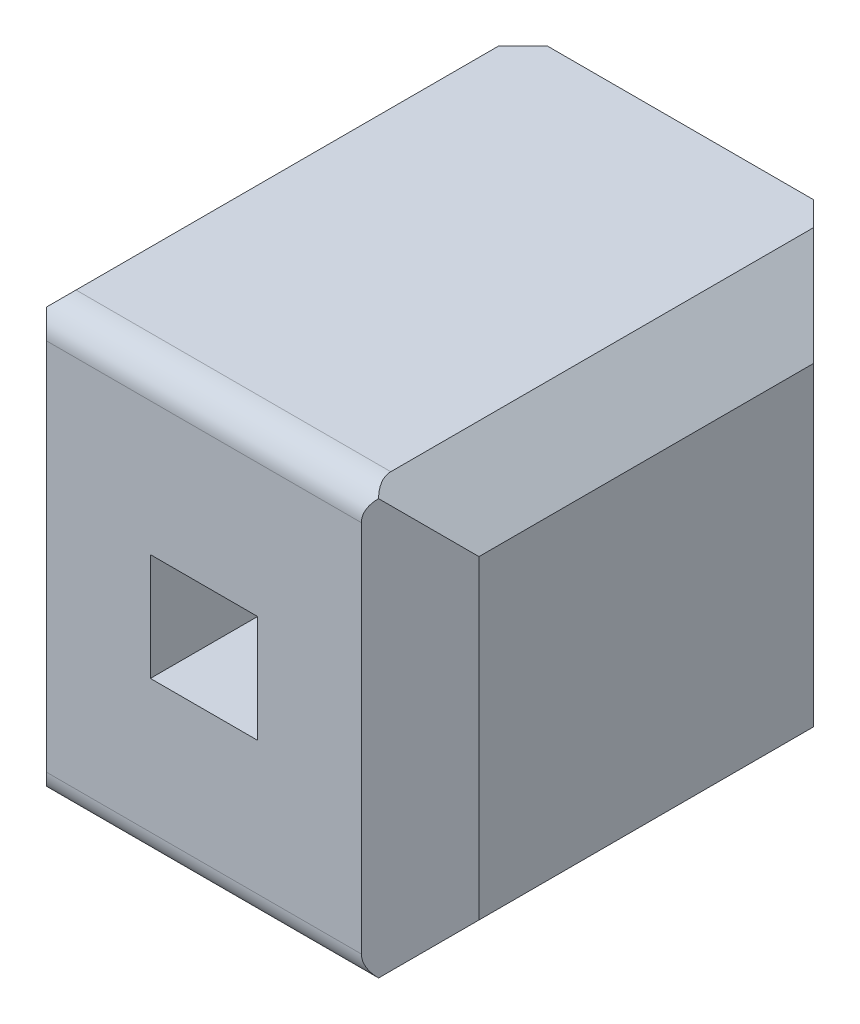
from build123d import *

# Parameters (mm, degrees)
BOSS_EXTRUDE1_DEPTH = 1.54
BOSS_EXTRUDE2_DEPTH = 0.5
SKETCH3_W           = 2.54
SKETCH3_H           = 2.04
BOSS_EXTRUDE3_DEPTH = 2.309999828
BOSS_EXTRUDE4_DEPTH = 0.5
SKETCH5_W           = 0.63
SKETCH5_H           = 0.63
CUT_EXTRUDE1_DEPTH  = 30.371228123
CHAMFER1_SIZE       = 0.345477186
FILLET1_R           = 0.172738636


with BuildPart() as part:
    # Sketch1 → Boss-Extrude1 (new body)
    with BuildSketch(Plane.XZ.offset(0.77)):
        Polygon((29.019999979, 0.299999943), (29.21, 0.49), (26.67, 0.49), (26.86, 0.299999943), align=None)
    extrude(amount=-BOSS_EXTRUDE1_DEPTH)

    # Sketch2 → Boss-Extrude2 (add)
    with BuildSketch(Plane(origin=(0, 0.77, 0), x_dir=(-1, 0, 0), z_dir=(0, 1, 0))):
        Polygon((-26.67, 0.49), (-27.158578644, 0.001421356), (-28.721421356, 0.001421356), (-29.21, 0.49), align=None)
    extrude(amount=BOSS_EXTRUDE2_DEPTH)

    # Sketch3 → Boss-Extrude3 (add)
    with BuildSketch(Plane.XY.offset(0.49)):
        with Locations((27.94, 0.25)):
            Rectangle(SKETCH3_W, SKETCH3_H)
    extrude(amount=BOSS_EXTRUDE3_DEPTH)

    # Sketch4 → Boss-Extrude4 (add)
    with BuildSketch(Plane.XZ.offset(0.77)):
        Polygon((29.21, 0.49), (28.721421356, 0.001421356), (27.158578644, 0.001421356), (26.67, 0.49), (26.67, 2.799999828), (29.21, 2.799999828), align=None)
    extrude(amount=BOSS_EXTRUDE4_DEPTH)

    # Sketch5 → Cut-Extrude1 (cut, through all)
    with BuildSketch(Plane.XY.offset(2.799999828)):
        with Locations((27.94, 0)):
            Rectangle(SKETCH5_W, SKETCH5_H)
    extrude(amount=-CUT_EXTRUDE1_DEPTH, mode=Mode.SUBTRACT)

    # Chamfer1
    chamfer1_edges = [part.edges().sort_by_distance(p)[0] for p in [
        (29.21, 1.27, 1.644999914),
        (29.21, 0, 2.799999828),
        (29.21, -1.27, 1.644999914),
        (26.67, -1.27, 1.644999914),
        (26.67, 1.27, 1.644999914),
        (26.67, 0, 2.799999828),
    ]]
    chamfer(chamfer1_edges, length=CHAMFER1_SIZE)

    # Fillet1
    fillet1_edges = [part.edges().sort_by_distance(p)[0] for p in [
        (27.94, -1.27, 2.799999828),
        (27.94, 1.27, 2.799999828),
    ]]
    fillet(fillet1_edges, radius=FILLET1_R)


solid = part.part
